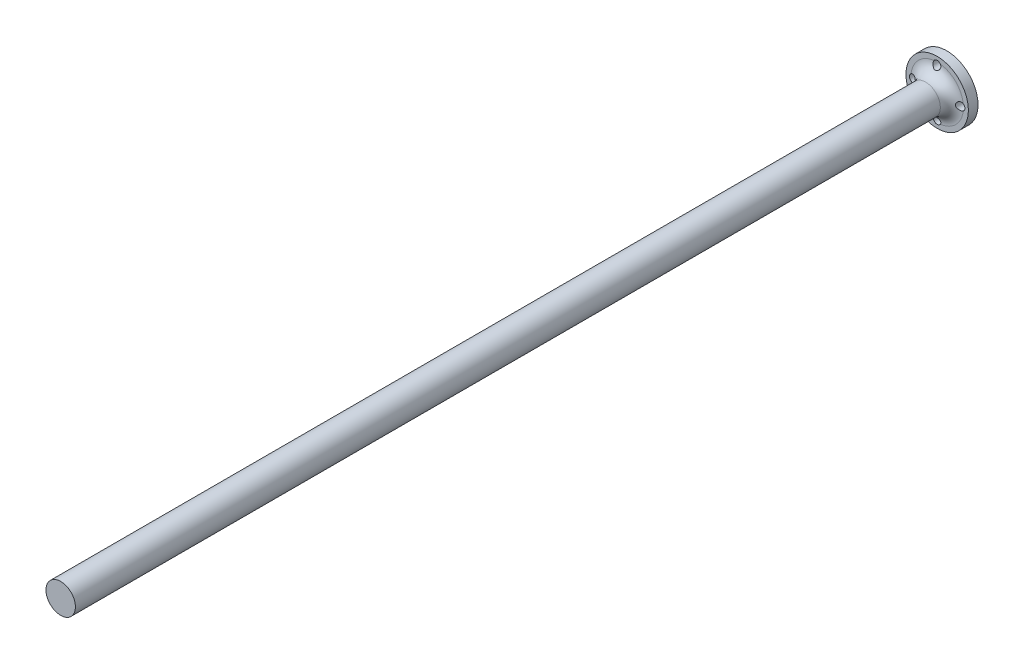
from build123d import *

# Parameters (mm, degrees)
SKETCH1_R           = 10.287
BOSS_EXTRUDE1_DEPTH = 3.175
SKETCH2_R           = 4.8514
BOSS_EXTRUDE2_DEPTH = 288.925
SKETCH3_R           = 4.064
CUT_EXTRUDE1_DEPTH  = 1.27
FILLET1_R           = 1.000000032
CUT_EXTRUDE2_REACH  = 294.462
SKETCH4_R           = 1.27
CIRPATTERN1_COUNT   = 4
FILLET2_R           = 3.81


with BuildPart() as part:
    # Sketch1 → Boss-Extrude1 (new body)
    with BuildSketch(Plane.XY):
        Circle(SKETCH1_R)
    extrude(amount=BOSS_EXTRUDE1_DEPTH)

    # Sketch2 → Boss-Extrude2 (add)
    with BuildSketch(Plane.XY.offset(3.175)):
        Circle(SKETCH2_R)
    extrude(amount=BOSS_EXTRUDE2_DEPTH)

    # Sketch3 → Cut-Extrude1 (cut)
    with BuildSketch(Plane(origin=(0, 0, 0), x_dir=(-1, 0, 0), z_dir=(0, 0, -1))):
        Circle(SKETCH3_R)
    extrude(amount=-CUT_EXTRUDE1_DEPTH, mode=Mode.SUBTRACT)

    # Fillet1
    fillet1_edges = [part.edges().sort_by_distance(p)[0] for p in [
        (4.064, 0, 0),
    ]]
    fillet(fillet1_edges, radius=FILLET1_R)

    # Sketch4 → Cut-Extrude2 (cut, up to next)
    with BuildSketch(Plane(origin=(0, 0, 0), x_dir=(-1, 0, 0), z_dir=(0, 0, -1)), mode=Mode.PRIVATE) as cut_extrude2_sk1:
        with Locations((0, 7.874)):
            Circle(SKETCH4_R)
    cut_extrude2_tool1 = extrude(cut_extrude2_sk1.sketch, amount=-CUT_EXTRUDE2_REACH, mode=Mode.PRIVATE) & part.part
    cut_extrude2 = cut_extrude2_tool1.solids().sort_by_distance((0, 7.874, 0))[0]
    add(cut_extrude2, mode=Mode.SUBTRACT)

    # CirPattern1: Cut-Extrude2 ×4 about axis
    cirpattern1_axis = Axis((0, 0, 0), (0, 0, 1))
    for i in range(1, CIRPATTERN1_COUNT):
        add(cut_extrude2.rotate(cirpattern1_axis, i * 360 / CIRPATTERN1_COUNT), mode=Mode.SUBTRACT)

    # Fillet2
    # the kernel refuses this fillet: 3.81 mm, written as the material it adds along each edge
    with BuildSketch(Plane(origin=(0, 0, 3.175), x_dir=(1, 0, 0), z_dir=(0, -1, 0))) as fillet2_piece_1_section:
        with BuildLine():
            CenterArc((4.8514 + FILLET2_R, FILLET2_R), FILLET2_R, 180, 90)
            Line((4.8514, FILLET2_R), (4.8514, 0))
            Line((4.8514, 0), (4.8514 + FILLET2_R, 0))
        make_face()
    fillet2_piece_1 = revolve(axis=Axis((0, 0, 3.175), (0, 0, 1)), mode=Mode.PRIVATE)
    fillet2_piece_1 = fillet2_piece_1 - Plane(origin=(-7.874, 0, 4.25520668), x_dir=(0, -1, 0), z_dir=(0, 0, -1)) * Cylinder(1.27, 35, mode=Mode.PRIVATE)
    fillet2_piece_1 = fillet2_piece_1 - Plane(origin=(0, -7.874, 4.25520668), x_dir=(1, 0, 0), z_dir=(0, 0, -1)) * Cylinder(1.27, 35, mode=Mode.PRIVATE)
    fillet2_piece_1 = fillet2_piece_1 - Plane(origin=(0, 7.874, 4.25520668), x_dir=(-1, 0, 0), z_dir=(0, 0, -1)) * Cylinder(1.27, 35, mode=Mode.PRIVATE)
    fillet2_piece_1 = fillet2_piece_1 - Plane(origin=(7.874, 0, 4.25520668), x_dir=(0, 1, 0), z_dir=(0, 0, -1)) * Cylinder(1.27, 35, mode=Mode.PRIVATE)
    add(fillet2_piece_1)


solid = part.part
